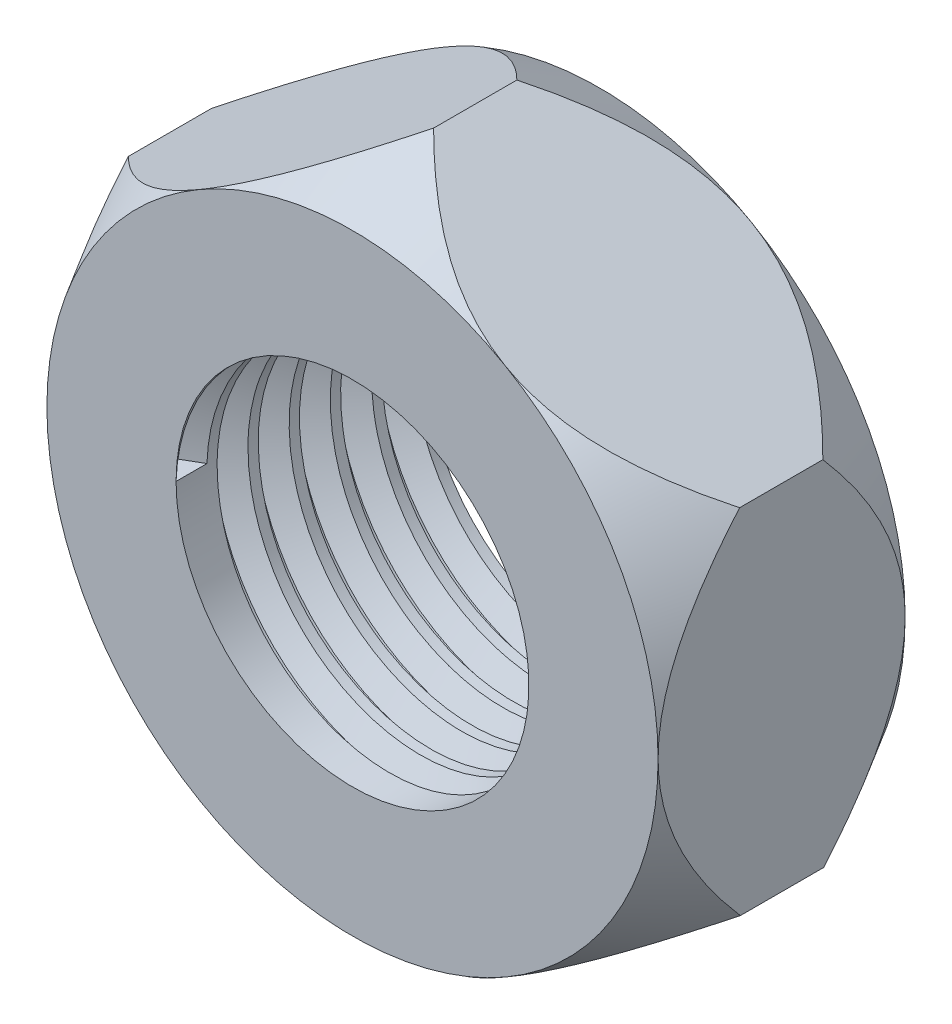
from build123d import *

# Parameters (mm, degrees)
BOSS_EXTRUDE1_DEPTH = 21
SKETCH2_OUTSIDE_W   = 94.704
SKETCH2_OUTSIDE_H   = 102.678
SKETCH2_OUTSIDE_R   = 25.980821886
CUT_EXTRUDE3_DEPTH  = 21
CUT_EXTRUDE3_DRAFT  = -30
SKETCH3_OUTSIDE_W   = 94.704
SKETCH3_OUTSIDE_H   = 102.678
SKETCH3_OUTSIDE_R   = 25.980821886
CUT_EXTRUDE4_DEPTH  = 21
CUT_EXTRUDE4_DRAFT  = -30
SKETCH4_R           = 15
CUT_EXTRUDE5_DEPTH  = 45.918514544
THREAD2_PITCH       = 3.5


with BuildPart() as part:
    # Sketch1 → Boss-Extrude1 (new body)
    with BuildSketch(Plane.XY):
        Polygon((25.948586123, 15.055730451), (-0.064351982, 30), (-26.012938104, 14.944269549), (-25.948586123, -15.055730451), (0.064351982, -30), (26.012938104, -14.944269549), align=None)
    extrude(amount=BOSS_EXTRUDE1_DEPTH)


with BuildPart() as cut_extrude3_tool:
    # Sketch2 outside → Cut-Extrude3 (with draft: the straight prism first)
    with BuildSketch(Plane.XY.offset(21)):
        Rectangle(SKETCH2_OUTSIDE_W, SKETCH2_OUTSIDE_H)
        Circle(SKETCH2_OUTSIDE_R, mode=Mode.SUBTRACT)
    extrude(amount=-CUT_EXTRUDE3_DEPTH)
    # Cut-Extrude3: the draft: its side faces are tilted about the plane it starts from
    cut_extrude3_sides = [cut_extrude3_tool.faces().sort_by_distance(p)[0] for p in [
        (0, -51.339, 10.5),
        (47.352, 0, 10.5),
        (0, 51.339, 10.5),
        (-47.352, 0, 10.5),
        (-25.980821886, 0, 10.5),
    ]]
    draft(cut_extrude3_sides, Plane.XY.offset(21), CUT_EXTRUDE3_DRAFT)


with BuildPart() as part_1:
    add(part.part)

    # Cut-Extrude3: cut by cut_extrude3_tool
    add(cut_extrude3_tool.part, mode=Mode.SUBTRACT)


with BuildPart() as cut_extrude4_tool:
    # Sketch3 outside → Cut-Extrude4 (with draft: the straight prism first)
    with BuildSketch(Plane(origin=(0, 0, 0), x_dir=(-1, 0, 0), z_dir=(0, 0, -1))):
        Rectangle(SKETCH3_OUTSIDE_W, SKETCH3_OUTSIDE_H)
        Circle(SKETCH3_OUTSIDE_R, mode=Mode.SUBTRACT)
    extrude(amount=-CUT_EXTRUDE4_DEPTH)
    # Cut-Extrude4: the draft: its side faces are tilted about the plane it starts from
    cut_extrude4_sides = [cut_extrude4_tool.faces().sort_by_distance(p)[0] for p in [
        (0, -51.339, 10.5),
        (-47.352, 0, 10.5),
        (0, 51.339, 10.5),
        (47.352, 0, 10.5),
        (25.980821886, 0, 10.5),
    ]]
    draft(cut_extrude4_sides, Plane(origin=(0, 0, 0), x_dir=(-1, 0, 0), z_dir=(0, 0, -1)), CUT_EXTRUDE4_DRAFT)


with BuildPart() as part_2:
    add(part_1.part)

    # Cut-Extrude4: cut by cut_extrude4_tool
    add(cut_extrude4_tool.part, mode=Mode.SUBTRACT)

    # Sketch4 → Cut-Extrude5 (cut, through all)
    with BuildSketch(Plane.XY.offset(21)):
        Circle(SKETCH4_R)
    extrude(amount=-CUT_EXTRUDE5_DEPTH, mode=Mode.SUBTRACT)

    # Thread2: the profile of Thread Profile2 profile screwed along a right-hand helix of 6 turns, 12 arcs to a turn; built about Z, then put on its axis
    thread2_z = Axis((0, 0, 0), (0, 0, 1))
    thread2_corners = [(14.9997, 0, -0.000173205), (16.894430562, 0, 1.093749995), (16.894430562, 0, 1.531249995), (14.9997, 0, 2.625173196)]
    with BuildLine(mode=Mode.PRIVATE) as thread2_profile:
        Line(thread2_corners[0], thread2_corners[1])
        Line(thread2_corners[1], thread2_corners[2])
        Line(thread2_corners[2], thread2_corners[3])
        Line(thread2_corners[3], thread2_corners[0])
    thread2_cap = Face(thread2_profile.wire())
    thread2_turn_angles = [0, 15, 30, 45, 60, 75, 90, 105, 120, 135, 150, 165, 180, 195, 210, 225, 240, 255, 270, 285, 300, 315, 330, 345, 360]
    thread2_turn_weights = [1, 0.9659258262890683, 1, 0.9659258262890683, 1, 0.9659258262890683, 1, 0.9659258262890683, 1, 0.9659258262890683, 1, 0.9659258262890683, 1, 0.9659258262890683, 1, 0.9659258262890683, 1, 0.9659258262890683, 1, 0.9659258262890683, 1, 0.9659258262890683, 1, 0.9659258262890683, 1]
    thread2_turn_rails = [Edge.make_bspline([Vector(p[0], p[1], 0).rotate(thread2_z, thread2_turn_angles[k]) / thread2_turn_weights[k] + Vector(0, 0, p[2] + THREAD2_PITCH * thread2_turn_angles[k] / 360) for k in range(25)], [0, 0, 0, 1, 1, 2, 2, 3, 3, 4, 4, 5, 5, 6, 6, 7, 7, 8, 8, 9, 9, 10, 10, 11, 11, 12, 12, 12], 2, thread2_turn_weights) for p in thread2_corners]
    thread2_turn_sides = [Face.make_surface_from_curves(thread2_turn_rails[p[0]], thread2_turn_rails[p[1]]) for p in [(0, 1), (1, 2), (2, 3), (3, 0)]]
    thread2 = Plane(origin=(0, 0, 21), x_dir=(-1, 0, 0), z_dir=(0, 0, -1)) * Solid(Shell([*[p.moved(Location((0, 0, THREAD2_PITCH * i))) for i in range(6) for p in thread2_turn_sides], thread2_cap, thread2_cap.rotate(thread2_z, 2160).moved(Location((0, 0, THREAD2_PITCH * 2160 / 360)))]))
    add(thread2, mode=Mode.SUBTRACT)


solid = part_2.part
